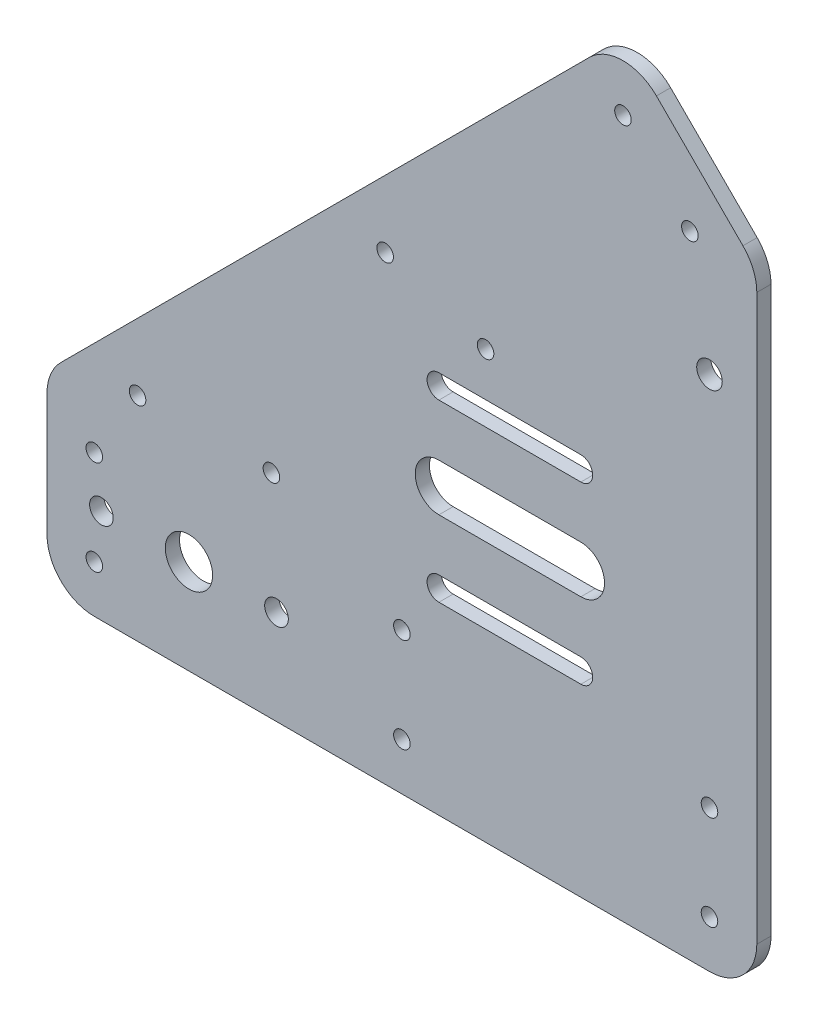
from build123d import *

# Parameters (mm, degrees)
SKETCH1_R           = 1.75
SKETCH1_R_2         = 2.5
SKETCH1_R_3         = 5
SKETCH1_R_4         = 2.7
BOSS_EXTRUDE1_DEPTH = 3
FILLET1_R           = 10


with BuildPart() as part:
    # Sketch1 → Boss-Extrude1 (new body)
    with BuildSketch(Plane.XY):
        Polygon((46.715728753, 141.715728753), (-75, 20), (-75, -20), (75, -20), (75, 20), (75, 113.431457505), align=None)
        with Locations((-65, -10)):
            Circle(SKETCH1_R, mode=Mode.SUBTRACT)
        with Locations((-63.5, 0)):
            Circle(SKETCH1_R_2, mode=Mode.SUBTRACT)
        with Locations((-45, 0)):
            Circle(SKETCH1_R_3, mode=Mode.SUBTRACT)
        with Locations((-65, 10)):
            Circle(SKETCH1_R, mode=Mode.SUBTRACT)
        with Locations((-26.5, 0)):
            Circle(SKETCH1_R_2, mode=Mode.SUBTRACT)
        with Locations((0, 10)):
            Circle(SKETCH1_R, mode=Mode.SUBTRACT)
        with Locations((-55.857864376, 25)):
            Circle(SKETCH1_R, mode=Mode.SUBTRACT)
        with Locations((-27.573593129, 25)):
            Circle(SKETCH1_R, mode=Mode.SUBTRACT)
        with Locations((0, -10)):
            Circle(SKETCH1_R, mode=Mode.SUBTRACT)
        with Locations((65, -10)):
            Circle(SKETCH1_R, mode=Mode.SUBTRACT)
        with Locations((65, 10)):
            Circle(SKETCH1_R, mode=Mode.SUBTRACT)
        with BuildLine():
            ThreePointArc((7.820236345, 19), (5.320236345, 21.5), (7.820236345, 24))
            Line((7.820236345, 24), (37.820236345, 24))
            ThreePointArc((37.820236345, 24), (40.320236345, 21.5), (37.820236345, 19))
            Line((37.820236345, 19), (7.820236345, 19))
        make_face(mode=Mode.SUBTRACT)
        with BuildLine():
            ThreePointArc((7.820236345, 35), (2.820236345, 40), (7.820236345, 45))
            Line((7.820236345, 45), (37.820236345, 45))
            ThreePointArc((37.820236345, 45), (42.820236345, 40), (37.820236345, 35))
            Line((37.820236345, 35), (7.820236345, 35))
        make_face(mode=Mode.SUBTRACT)
        with BuildLine():
            ThreePointArc((7.820236345, 56), (5.320236345, 58.5), (7.820236345, 61))
            Line((7.820236345, 61), (37.820236345, 61))
            ThreePointArc((37.820236345, 61), (40.320236345, 58.5), (37.820236345, 56))
            Line((37.820236345, 56), (7.820236345, 56))
        make_face(mode=Mode.SUBTRACT)
        with Locations((-3.535533906, 77.32233047)):
            Circle(SKETCH1_R, mode=Mode.SUBTRACT)
        with Locations((17.67766953, 70.251262658)):
            Circle(SKETCH1_R, mode=Mode.SUBTRACT)
        with Locations((65, 89.289321881)):
            Circle(SKETCH1_R_4, mode=Mode.SUBTRACT)
        with Locations((60.857864376, 113.431457505)):
            Circle(SKETCH1_R, mode=Mode.SUBTRACT)
        with Locations((46.715728753, 127.573593129)):
            Circle(SKETCH1_R, mode=Mode.SUBTRACT)
    extrude(amount=BOSS_EXTRUDE1_DEPTH)

    # Fillet1
    fillet1_edges = [part.edges().sort_by_distance(p)[0] for p in [
        (75, -20, 1.5),
        (-75, -20, 1.5),
        (46.715728753, 141.715728753, 1.5),
        (75, 113.431457505, 1.5),
        (-75, 20, 1.5),
    ]]
    fillet(fillet1_edges, radius=FILLET1_R)


solid = part.part
